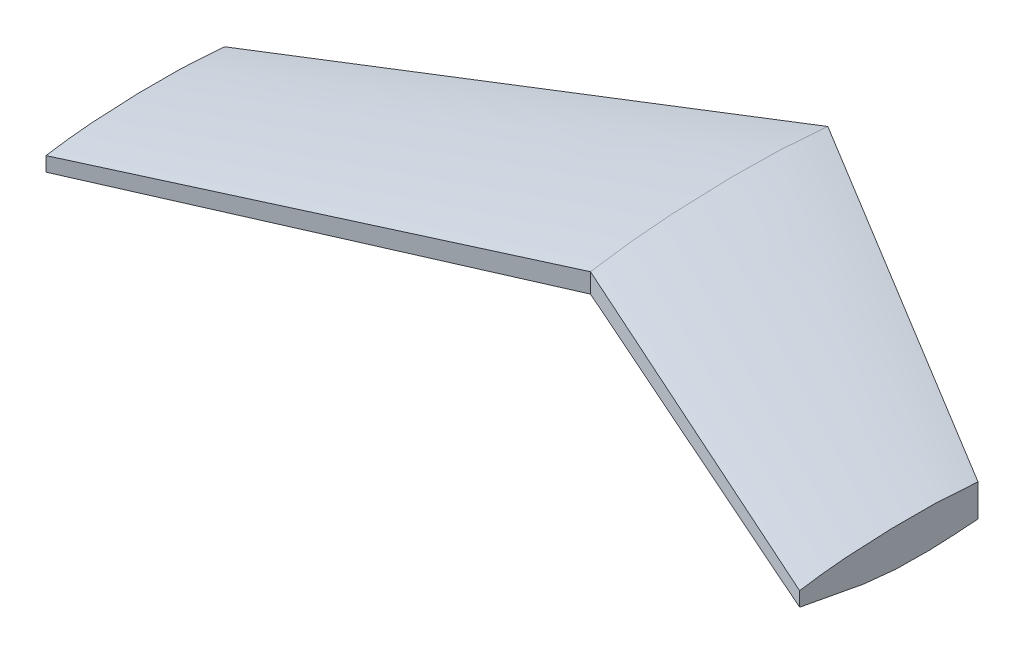
from build123d import *

# Parameters (mm, degrees)
SKETCH4_W          = 14453.89622635
SKETCH4_H          = 1933.47388346
CUT_EXTRUDE1_DEPTH = 11582.4


with BuildPart() as part:
    # Surface-Knit3: read off the stored shape, not the designer's step
    # Surface-Knit3: loft between two sections, ruled curve by curve
    surface_knit3_from = [
        Edge.make_bspline([(-18747.913519228, -33.291870667, 13896.687632722), (-18747.913519228, -38.996184814, 13864.165767164), (-18747.913519228, -47.395291612, 13815.326003064), (-18747.913519228, -58.165952375, 13750.098143781), (-18747.913519228, -66.001529187, 13701.124565247), (-18747.913519228, -73.566342631, 13652.099705476), (-18747.913519228, -80.832031101, 13603.025026666), (-18747.913519228, -87.770232991, 13553.901991014), (-18747.913519228, -94.352615351, 13504.731967053), (-18747.913519228, -100.550845229, 13455.516323317), (-18747.913519228, -106.336535483, 13406.256569089), (-18747.913519228, -111.681298966, 13356.954213653), (-18747.913519229, -116.556993503, 13307.61047422), (-18747.913519228, -120.934768836, 13258.226931647), (-18747.913519228, -124.787293043, 13208.804970061), (-18747.913519228, -128.084117978, 13159.345935701), (-18747.913519228, -130.802699249, 13109.851595466), (-18747.913519228, -132.971906369, 13060.326885108), (-18747.913519228, -134.6147206, 13010.776434683), (-18747.913519229, -135.756697629, 12961.204893031), (-18747.913519228, -136.422147725, 12911.6170991), (-18747.913519228, -136.635930916, 12862.017549986), (-18747.913519229, -136.422737614, 12812.411014843), (-18747.913519229, -135.807258229, 12762.802262828), (-18747.913519228, -134.814210194, 12713.195933045), (-18747.913519229, -133.468310939, 12663.596664599), (-18747.913519229, -131.794267082, 12614.009184506), (-18747.913519228, -129.816785237, 12564.438219781), (-18747.913519228, -126.808507959, 12498.371846627), (-18747.913519229, -122.413125762, 12415.853516057), (-18747.913519228, -118.351231597, 12349.932887402), (-18747.913519228, -116.216834875, 12317.002326935)], [0, 0, 0, 0, 0.0625, 0.09375, 0.125, 0.15625, 0.1875, 0.21875, 0.25, 0.28125, 0.3125, 0.34375, 0.375, 0.40625, 0.4375, 0.46875, 0.5, 0.53125, 0.5625, 0.59375, 0.625, 0.65625, 0.6875, 0.71875, 0.75, 0.78125, 0.8125, 0.84375, 0.875, 0.9375, 1, 1, 1, 1], 3),
        Edge.make_bspline([(-18747.913519228, 119.318075617, 12317.002326935), (-18747.913519228, 121.427288002, 12349.906607435), (-18747.913519229, 125.245922776, 12415.730130778), (-18747.913519228, 129.825309485, 12514.504470047), (-18747.913519228, 133.30695484, 12613.31210814), (-18747.913519229, 135.741648881, 12712.147152624), (-18747.913519228, 136.940477423, 12794.527823229), (-18747.913519228, 137.426859553, 12860.440198394), (-18747.913519229, 137.561675928, 12909.877734467), (-18747.913519228, 137.472892207, 12959.317860595), (-18747.913519228, 137.166808865, 13008.759745982), (-18747.913519229, 136.649726377, 13058.202559828), (-18747.913519228, 135.92839574, 13107.645897141), (-18747.913519229, 135.008041704, 13157.088667935), (-18747.913519228, 133.897934193, 13206.530592909), (-18747.913519229, 132.578650086, 13255.9684353), (-18747.913519228, 131.024813307, 13305.398752426), (-18747.913519229, 129.212987855, 13354.817901918), (-18747.913519229, 127.119170545, 13404.222444449), (-18747.913519228, 124.719358193, 13453.608940689), (-18747.913519228, 121.079727689, 13519.428839404), (-18747.913519229, 115.645624536, 13601.640967503), (-18747.913519228, 107.517806813, 13700.167248777), (-18747.913519228, 97.591624664, 13798.537247751), (-18747.913519228, 89.647575896, 13863.994418396), (-18747.913519228, 85.311986798, 13896.687632722)], [0, 0, 0, 0, 0.0625, 0.125, 0.1875, 0.25, 0.3125, 0.34375, 0.375, 0.40625, 0.4375, 0.46875, 0.5, 0.53125, 0.5625, 0.59375, 0.625, 0.65625, 0.6875, 0.71875, 0.75, 0.8125, 0.875, 0.9375, 1, 1, 1, 1], 3),
        Edge.make_line((-18747.913519228, -116.216834875, 12317.002326935), (-18747.913519228, 119.318075617, 12317.002326935)),
        Edge.make_line((-18747.913519228, 85.311986798, 13896.687632722), (-18747.913519228, -33.291870667, 13896.687632722)),
    ]
    surface_knit3_to = [
        Edge.make_bspline([(0, -84.232166366, 5554.937339031), (0, -101.79672971, 5462.01880107), (0, -129.357236092, 5322.688455814), (0, -167.450345309, 5136.915845411), (0, -196.42273433, 4997.563298319), (0, -225.527238329, 4858.164324098), (0, -254.493580408, 4718.695334102), (0, -283.051234262, 4579.132854165), (0, -310.930075038, 4439.453396797), (0, -337.859297077, 4299.633408984), (0, -363.569297954, 4159.649494874), (0, -387.788376954, 4019.477965049), (0, -410.248359478, 3879.095632891), (0, -430.67509131, 3738.47845439), (0, -448.805142559, 3597.603925682), (0, -464.354292773, 3456.446555804), (0, -477.089703526, 3314.988236979), (0, -487.191948377, 3173.270264273), (0, -494.801263778, 3031.328137811), (0, -500.07567179, 2889.199911148), (0, -503.164086093, 2746.922333211), (0, -504.220248686, 2604.532838899), (0, -503.395317672, 2462.068506491), (0, -500.841843712, 2319.566586545), (0, -496.711615776, 2177.064276035), (0, -491.156848446, 2034.598715165), (0, -484.32952174, 1892.20725343), (0, -476.381724655, 1749.92678358), (0, -464.49346954, 1560.417817143), (0, -447.592223813, 1323.994831696), (0, -432.705315369, 1135.550220194), (0, -425.123116762, 1041.550751068)], [0, 0, 0, 0, 0.0625, 0.09375, 0.125, 0.15625, 0.1875, 0.21875, 0.25, 0.28125, 0.3125, 0.34375, 0.375, 0.40625, 0.4375, 0.46875, 0.5, 0.53125, 0.5625, 0.59375, 0.625, 0.65625, 0.6875, 0.71875, 0.75, 0.78125, 0.8125, 0.84375, 0.875, 0.9375, 1, 1, 1, 1], 3),
        Edge.make_bspline([(0, 419.597820632, 1041.550751068), (0, 429.543853386, 1135.440295654), (0, 447.399313962, 1323.348388039), (0, 468.40352921, 1605.540291192), (0, 483.959642332, 1888.004992674), (0, 494.398471436, 2170.685059083), (0, 499.108853625, 2406.384051023), (0, 500.649329193, 2594.993626218), (0, 500.73224947, 2736.469141906), (0, 499.783776553, 2877.955586877), (0, 497.845912984, 3019.446002413), (0, 494.958769462, 3160.933085391), (0, 491.166077703, 3302.409896298), (0, 486.504516068, 3443.868951949), (0, 481.026248706, 3585.30385973), (0, 474.686548897, 3726.701576336), (0, 467.416919745, 3868.047425633), (0, 459.158051456, 4009.327380859), (0, 449.846016915, 4150.527054909), (0, 439.419277989, 4291.632309199), (0, 423.947050764, 4479.627594019), (0, 401.507651798, 4714.314399047), (0, 369.122895613, 4995.332543897), (0, 330.781905006, 5275.630891051), (0, 300.917896127, 5461.940505183), (0, 284.826924337, 5554.937339031)], [0, 0, 0, 0, 0.0625, 0.125, 0.1875, 0.25, 0.3125, 0.34375, 0.375, 0.40625, 0.4375, 0.46875, 0.5, 0.53125, 0.5625, 0.59375, 0.625, 0.65625, 0.6875, 0.71875, 0.75, 0.8125, 0.875, 0.9375, 1, 1, 1, 1], 3),
        Edge.make_line((0, -425.123116762, 1041.550751068), (0, 419.597820632, 1041.550751068)),
        Edge.make_line((0, 284.826924337, 5554.937339031), (0, -84.232166366, 5554.937339031)),
    ]
    surface_knit3 = Solid(Shell([*[Face.make_surface_from_curves(surface_knit3_from[k], surface_knit3_to[k]) for k in range(4)], Face(Wire(surface_knit3_from)), Face(Wire(surface_knit3_to))]))
    add(surface_knit3)

    # Sketch4 → Cut-Extrude1 (cut)
    with BuildSketch(Plane(origin=(-18747.913519229, 0, 0), x_dir=(0, 0, -1), z_dir=(1, 0, 0))):
        with Locations((-7774.786517892, 36.739287504)):
            Rectangle(SKETCH4_W, SKETCH4_H)
    extrude(amount=CUT_EXTRUDE1_DEPTH, mode=Mode.SUBTRACT)

    # Mirror1: part across plane


with BuildPart() as part_1:
    add(part.part)
    add(part.part.mirror(Plane(origin=(0, 0, 0), x_dir=(0, 0, 1), z_dir=(1, 0, 0))))


solid = part_1.part
